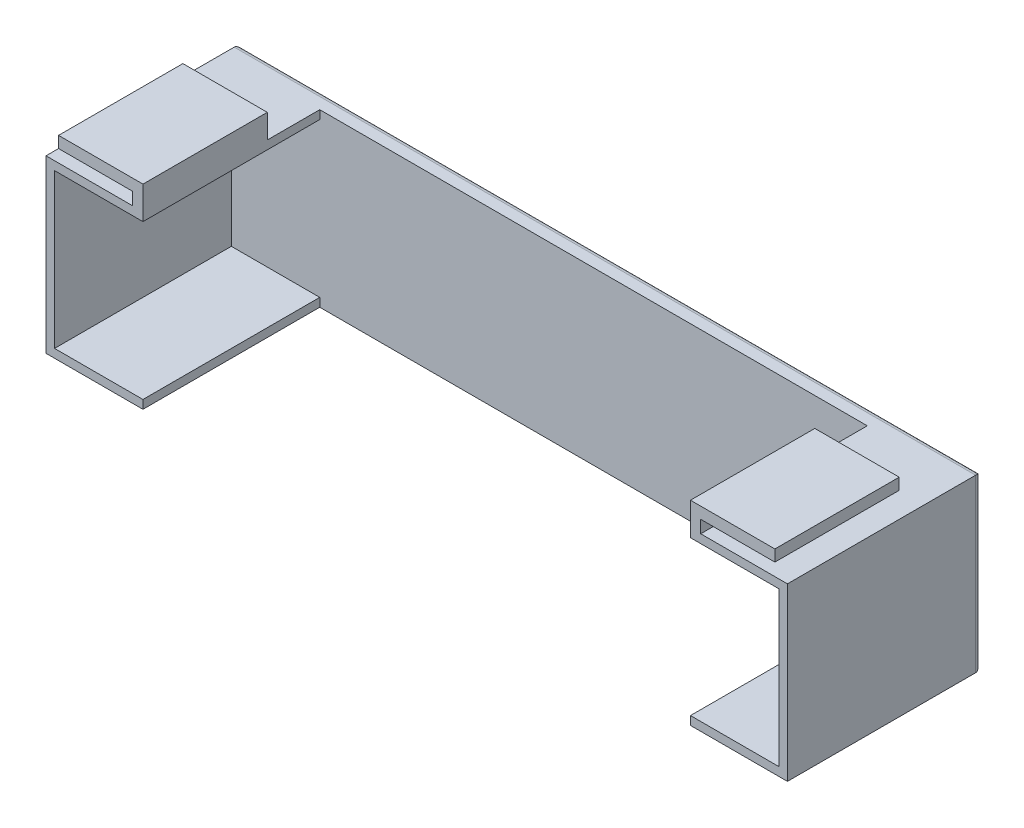
from build123d import *

# Parameters (mm, degrees)
ESQUISSE1_W        = 130
ESQUISSE1_H        = 30
BOSS_EXTRU_1_DEPTH = 1
BOSS_EXTRU_2_DEPTH = 31
ESQUISSE5_W        = 1.8
ESQUISSE5_H        = 21.8
BOSS_EXTRU_4_DEPTH = 2.2
ESQUISSE6_W        = 14.8
ESQUISSE6_H        = 21.8
BOSS_EXTRU_5_DEPTH = 2
ESQUISSE3_W        = 130
ESQUISSE3_H        = 30
ESQUISSE3_W_2      = 126
ESQUISSE3_H_2      = 26
BOSS_EXTRU_3_DEPTH = 2
CONG_1_R           = 1


with BuildPart() as part:
    # Esquisse1 → Boss.-Extru.1 (new body)
    with BuildSketch(Plane.XY):
        with Locations((65, 15)):
            Rectangle(ESQUISSE1_W, ESQUISSE1_H)
    extrude(amount=BOSS_EXTRU_1_DEPTH)

    # Esquisse2 → Boss.-Extru.2 (add)
    with BuildSketch(Plane.XY.offset(1)):
        Polygon((128.5, 28.5), (113, 28.5), (113, 30), (130, 30), (130, 0), (113, 0), (113, 1.5), (128.5, 1.5), align=None)
        Polygon((1.5, 28.5), (1.5, 1.5), (17, 1.5), (17, 0), (0, 0), (0, 30), (17, 30), (17, 28.5), align=None)
    extrude(amount=BOSS_EXTRU_2_DEPTH)

    # Esquisse5 → Boss.-Extru.4 (add)
    with BuildSketch(Plane(origin=(0, 30, 0), x_dir=(1, 0, 0), z_dir=(0, 1, 0))):
        with Locations((16.1, -21.1)):
            Rectangle(ESQUISSE5_W, ESQUISSE5_H)
        with Locations((113.9, -21.1)):
            Rectangle(ESQUISSE5_W, ESQUISSE5_H)
    extrude(amount=BOSS_EXTRU_4_DEPTH)

    # Esquisse6 → Boss.-Extru.5 (add)
    with BuildSketch(Plane(origin=(0, 32.2, 0), x_dir=(1, 0, 0), z_dir=(0, 1, 0))):
        with Locations((9.6, -21.1)):
            Rectangle(ESQUISSE6_W, ESQUISSE6_H)
        with Locations((120.4, -21.1)):
            Rectangle(ESQUISSE6_W, ESQUISSE6_H)
    extrude(amount=BOSS_EXTRU_5_DEPTH)

    # Esquisse3 → Boss.-Extru.3 (add)
    with BuildSketch(Plane(origin=(0, 0, 0), x_dir=(-1, 0, 0), z_dir=(0, 0, -1))):
        with Locations((-65, 15)):
            Rectangle(ESQUISSE3_W, ESQUISSE3_H)
        with Locations((-65, 15)):
            Rectangle(ESQUISSE3_W_2, ESQUISSE3_H_2, mode=Mode.SUBTRACT)
    extrude(amount=BOSS_EXTRU_3_DEPTH)

    # Congé1
    cong_1_edges = [part.edges().sort_by_distance(p)[0] for p in [
        (65, 28, 0),
        (2, 15, 0),
        (65, 2, 0),
        (128, 15, 0),
        (2, 15, -2),
        (65, 28, -2),
        (128, 15, -2),
        (65, 2, -2),
        (130, 15, -2),
        (65, 30, -2),
        (0, 15, -2),
        (65, 0, -2),
    ]]
    fillet(cong_1_edges, radius=CONG_1_R - 0.0001)  # a hair under: the kernel refuses the full size


solid = part.part
